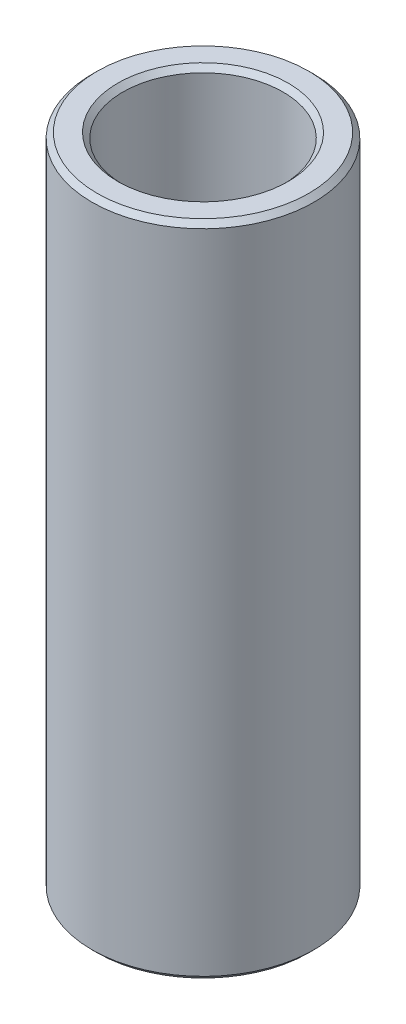
from build123d import *

# Parameters (mm, degrees)
SKETCH1_R           = 12.5
BOSS_EXTRUDE1_DEPTH = 74.094498993
SKETCH2_R           = 9.026134395
CUT_EXTRUDE1_DEPTH  = 77.174108337
CHAMFER1_SIZE       = 0.577260714


with BuildPart() as part:
    # Sketch1 → Boss-Extrude1 (new body)
    with BuildSketch(Plane(origin=(0, 0, 0), x_dir=(1, 0, 0), z_dir=(0, 1, 0))):
        Circle(SKETCH1_R)
    extrude(amount=BOSS_EXTRUDE1_DEPTH)

    # Sketch2 → Cut-Extrude1 (cut, through all)
    with BuildSketch(Plane(origin=(0, 0, 0), x_dir=(1, 0, 0), z_dir=(0, 1, 0))):
        Circle(SKETCH2_R)
    extrude(amount=CUT_EXTRUDE1_DEPTH, mode=Mode.SUBTRACT)

    # Chamfer1
    chamfer1_edges = [part.edges().sort_by_distance(p)[0] for p in [
        (-9.026134395, 74.094498993, 0),
        (-9.026134395, 0, 0),
        (-12.5, 0, 0),
        (-12.5, 74.094498993, 0),
    ]]
    chamfer(chamfer1_edges, length=CHAMFER1_SIZE)


solid = part.part
